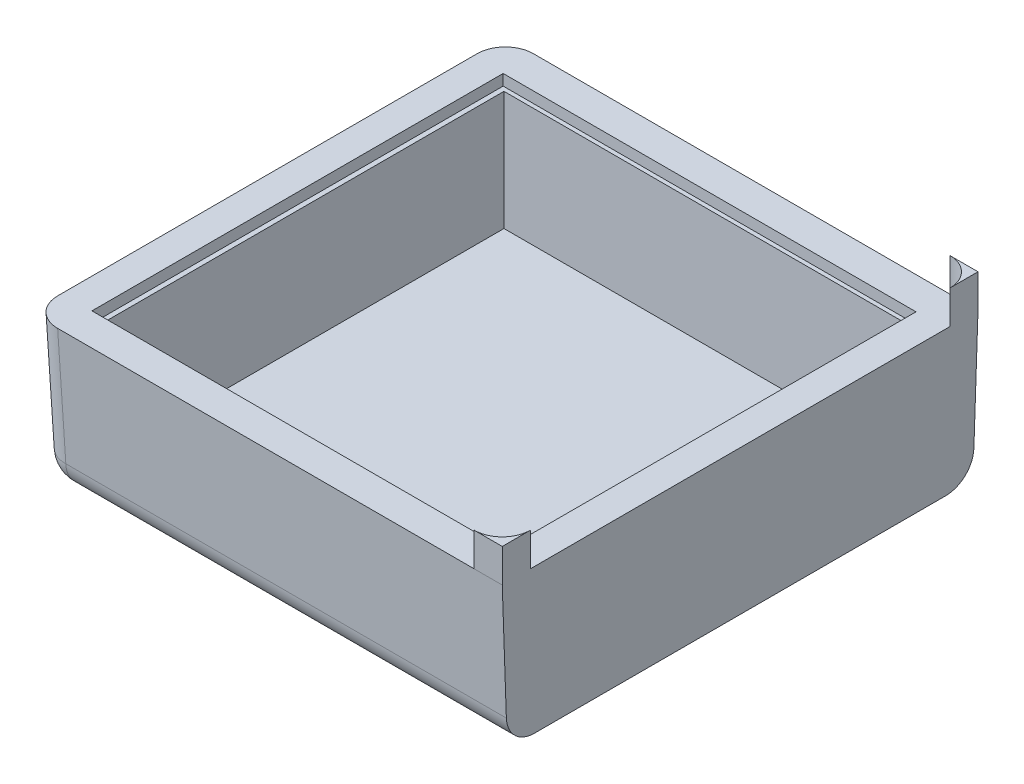
from build123d import *

# Parameters (mm, degrees)
SKETCH1_W               = 295
SKETCH1_H               = 292.1
BOSS_EXTRUDE1_DEPTH     = 88.69
BOSS_EXTRUDE1_DRAFT     = -2
SKETCH3_W               = 253.5
SKETCH3_H               = 252.5
CUT_EXTRUDE3_DEPTH      = 6.5
CUT_EXTRUDE3_DRAFT      = -2
SKETCH5_W               = 247
SKETCH5_H               = 247
CUT_EXTRUDE4_DEPTH      = 70.5
CUT_EXTRUDE4_DRAFT      = -2
CUT_EXTRUDE5_DEPTH      = 228.203831614
CUT_EXTRUDE5_DEPTH_BACK = 228.203831614
FILLET2_R               = 17.27
BOSS_EXTRUDE2_DEPTH     = 20.53


with BuildPart() as part:
    # Sketch1 → Boss-Extrude1 (with draft: the straight prism first)
    with BuildSketch(Plane(origin=(0, 0, 0), x_dir=(1, 0, 0), z_dir=(0, 1, 0))):
        with Locations((2.25, 0)):
            Rectangle(SKETCH1_W, SKETCH1_H)
    extrude(amount=-BOSS_EXTRUDE1_DEPTH)
    # Boss-Extrude1: the draft: its side faces are tilted about the plane it starts from
    boss_extrude1_sides = [part.faces().sort_by_distance(p)[0] for p in [
        (2.25, -44.345, 146.05),
        (149.75, -44.345, 0),
        (2.25, -44.345, -146.05),
        (-145.25, -44.345, 0),
    ]]
    draft(boss_extrude1_sides, Plane(origin=(0, 0, 0), x_dir=(1, 0, 0), z_dir=(0, 1, 0)), BOSS_EXTRUDE1_DRAFT)


with BuildPart() as cut_extrude3_tool:
    # Sketch3 → Cut-Extrude3 (with draft: the straight prism first)
    with BuildSketch(Plane(origin=(0, 0, 0), x_dir=(1, 0, 0), z_dir=(0, 1, 0))):
        Rectangle(SKETCH3_W, SKETCH3_H)
    extrude(amount=-CUT_EXTRUDE3_DEPTH)
    # Cut-Extrude3: the draft: its side faces are tilted about the plane it starts from
    cut_extrude3_sides = [cut_extrude3_tool.faces().sort_by_distance(p)[0] for p in [
        (0, -3.25, 126.25),
        (126.75, -3.25, 0),
        (0, -3.25, -126.25),
        (-126.75, -3.25, 0),
    ]]
    draft(cut_extrude3_sides, Plane(origin=(0, 0, 0), x_dir=(1, 0, 0), z_dir=(0, 1, 0)), CUT_EXTRUDE3_DRAFT)


with BuildPart() as part_1:
    add(part.part)

    # Cut-Extrude3: cut by cut_extrude3_tool
    add(cut_extrude3_tool.part, mode=Mode.SUBTRACT)


with BuildPart() as cut_extrude4_tool:
    # Sketch5 → Cut-Extrude4 (with draft: the straight prism first)
    with BuildSketch(Plane(origin=(0, -6.5, 0), x_dir=(1, 0, 0), z_dir=(0, 1, 0))):
        Rectangle(SKETCH5_W, SKETCH5_H)
    extrude(amount=-CUT_EXTRUDE4_DEPTH)
    # Cut-Extrude4: the draft: its side faces are tilted about the plane it starts from
    cut_extrude4_sides = [cut_extrude4_tool.faces().sort_by_distance(p)[0] for p in [
        (0, -41.75, 123.5),
        (123.5, -41.75, 0),
        (0, -41.75, -123.5),
        (-123.5, -41.75, 0),
    ]]
    draft(cut_extrude4_sides, Plane(origin=(0, -6.5, 0), x_dir=(1, 0, 0), z_dir=(0, 1, 0)), CUT_EXTRUDE4_DRAFT)


with BuildPart() as part_2:
    add(part_1.part)

    # Cut-Extrude4: cut by cut_extrude4_tool
    add(cut_extrude4_tool.part, mode=Mode.SUBTRACT)

    # Sketch6 → Cut-Extrude5 (cut, two sides: drawn at the far end of the back side and taken through both)
    with BuildSketch(Plane.XY.offset(-CUT_EXTRUDE5_DEPTH_BACK)):
        Polygon((149.75, 0), (145, 0), (145, -88.69), (146.652876954, -88.69), align=None)
    extrude(amount=CUT_EXTRUDE5_DEPTH + CUT_EXTRUDE5_DEPTH_BACK, mode=Mode.SUBTRACT)

    # Fillet2
    fillet2_edges = [part_2.edges().sort_by_distance(p)[0] for p in [
        (1.423561523, -88.69, -142.952876954),
        (-143.701438477, -44.345, -144.501438477),
        (-142.152876954, -88.69, 0),
        (-143.701438477, -44.345, 144.501438477),
        (1.423561523, -88.69, 142.952876954),
    ]]
    fillet(fillet2_edges, radius=FILLET2_R)

    # Sketch7 → Boss-Extrude2 (add)
    with BuildSketch(Plane(origin=(0, 0, 0), x_dir=(1, 0, 0), z_dir=(0, 1, 0))):
        with BuildLine():
            Line((145, 128.78), (145, 146.05))
            Line((145, 146.05), (127.73, 146.05))
            ThreePointArc((127.73, 146.05), (139.941734111, 140.991734111), (145, 128.78))
        make_face()
        with BuildLine():
            Line((145, -146.05), (127.73, -146.05))
            ThreePointArc((127.73, -146.05), (139.941734111, -140.991734111), (145, -128.78))
            Line((145, -128.78), (145, -146.05))
        make_face()
    extrude(amount=BOSS_EXTRUDE2_DEPTH)


solid = part_2.part
